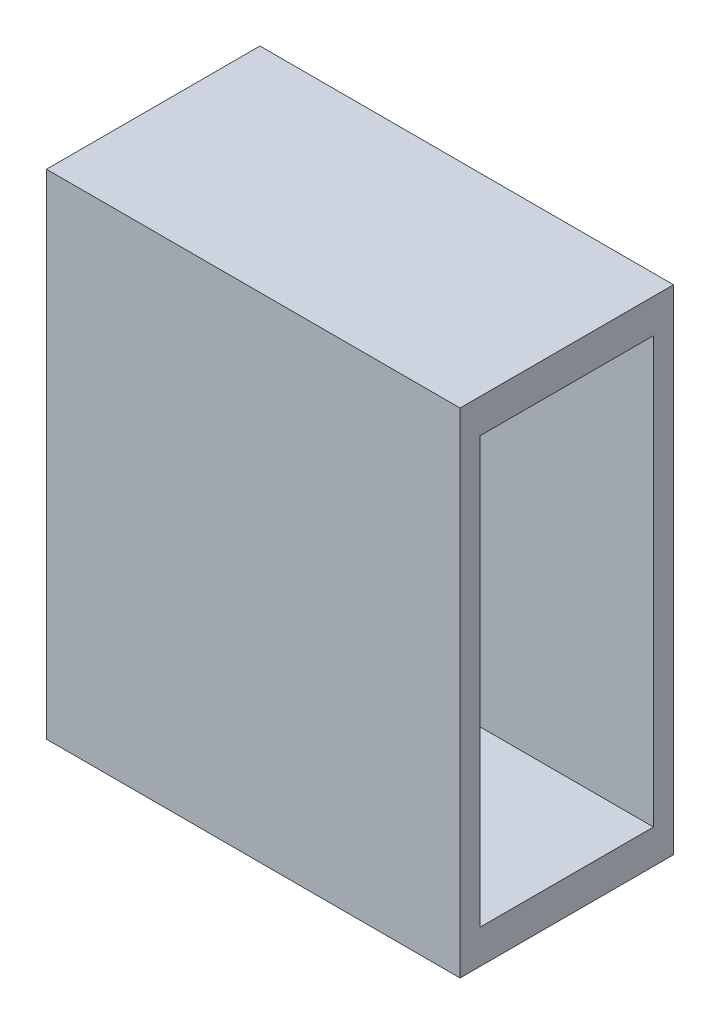
from build123d import *

# Parameters (mm, degrees)
SKETCH1_W           = 37
SKETCH1_H           = 16
BOSS_EXTRUDE1_DEPTH = 26
SKETCH1_3_W         = 4.2
SKETCH1_3_H         = 13
BOSS_EXTRUDE2_DEPTH = 2
SKETCH3_W           = 37
SKETCH3_H           = 16
SKETCH3_W_2         = 31.9
SKETCH3_H_2         = 13
BOSS_EXTRUDE4_DEPTH = 3.5
SKETCH5_W           = 37
SKETCH5_H           = 16
SKETCH5_R           = 5.2
BOSS_EXTRUDE5_DEPTH = 1.5
CUT_EXTRUDE5_DEPTH  = 1.5
SKETCH11_7_R        = 0.15
CUT_EXTRUDE12_DEPTH = 2


with BuildPart() as part:
    # Sketch1 → Boss-Extrude1 (new body)
    with BuildSketch(Plane.YZ):
        with Locations((-18.5, 8)):
            Rectangle(SKETCH1_W, SKETCH1_H)
        Polygon((-34.45, 14.5), (-30.25, 14.5), (-6.75, 14.5), (-2.55, 14.5), (-2.55, 1.5), (-6.75, 1.5), (-30.25, 1.5), (-34.45, 1.5), align=None, mode=Mode.SUBTRACT)
    extrude(amount=BOSS_EXTRUDE1_DEPTH)

    # Sketch1<3> → Boss-Extrude2 (add)
    with BuildSketch(Plane.YZ):
        with Locations((-32.35, 8)):
            Rectangle(SKETCH1_3_W, SKETCH1_3_H)
        with Locations((-4.65, 8)):
            Rectangle(SKETCH1_3_W, SKETCH1_3_H)
    extrude(amount=BOSS_EXTRUDE2_DEPTH)

    # Sketch3 → Boss-Extrude4 (add)
    with BuildSketch(Plane(origin=(0, 0, 0), x_dir=(0, -1, 0), z_dir=(-1, 0, 0))):
        with Locations((18.5, 8)):
            Rectangle(SKETCH3_W, SKETCH3_H)
        with Locations((18.5, 8)):
            Rectangle(SKETCH3_W_2, SKETCH3_H_2, mode=Mode.SUBTRACT)
    extrude(amount=BOSS_EXTRUDE4_DEPTH)

    # Sketch5 → Boss-Extrude5 (add)
    with BuildSketch(Plane(origin=(-3.5, 0, 0), x_dir=(0, -1, 0), z_dir=(-1, 0, 0))):
        with Locations((18.5, 8)):
            Rectangle(SKETCH5_W, SKETCH5_H)
        with Locations((23.25, 8)):
            Circle(SKETCH5_R, mode=Mode.SUBTRACT)
    extrude(amount=BOSS_EXTRUDE5_DEPTH)

    # Sketch11 → Cut-Extrude5 (cut)
    with BuildSketch(Plane.XZ.offset(37)):
        with BuildLine():
            ThreePointArc((17.375, 4.4), (20.975, 8), (17.375, 11.6))
            Line((17.375, 11.6), (2.375, 10.35))
            ThreePointArc((2.375, 10.35), (0.025, 8), (2.375, 5.65))
            Line((2.375, 5.65), (17.375, 4.4))
        make_face()
    extrude(amount=-CUT_EXTRUDE5_DEPTH, mode=Mode.SUBTRACT)

    # Sketch11<7> → Cut-Extrude12 (cut)
    with BuildSketch(Plane.XZ.offset(37)):
        with Locations((2.375, 8)):
            Circle(SKETCH11_7_R)
        with Locations((17.375, 8)):
            Circle(SKETCH11_7_R)
    extrude(amount=-CUT_EXTRUDE12_DEPTH, mode=Mode.SUBTRACT)


solid = part.part
